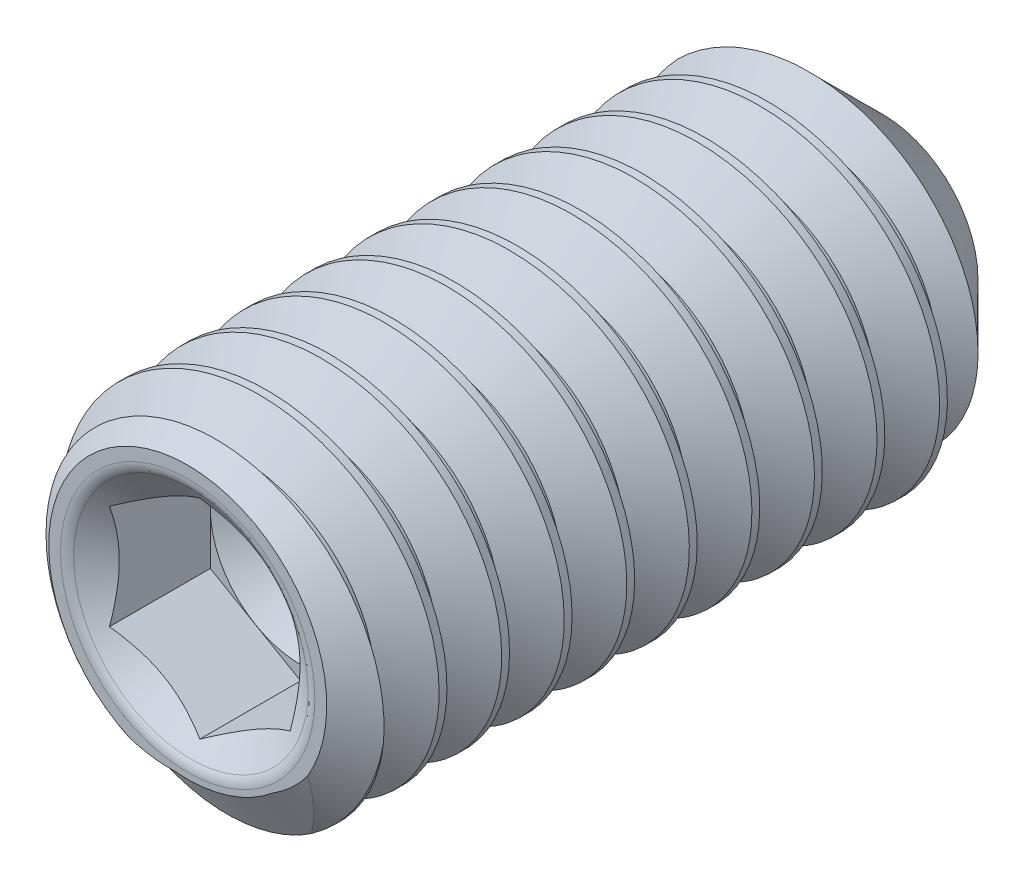
from build123d import *

# Parameters (mm, degrees)
CUT_SWEEP2_PITCH    = 0.45
CUT_EXTRUDE10_DEPTH = 0.8125
FILLET2_R           = 0.124722325


with BuildPart() as part:
    # Sketch22 → Revolve1 (revolve)
    with BuildSketch(Plane(origin=(0, 0, 0), x_dir=(0, 0, -1), z_dir=(1, 0, 0)), mode=Mode.PRIVATE) as revolve1_sk:
        Polygon((-2.294218417, 0), (-2.294218417, 1), (-2.119166532, 1.25), (2.140737716, 1.25), (2.705781583, 0.684956133), (2.294218417, 0), align=None)
    revolve(revolve1_sk.sketch.rotate(Axis((0, 0, -2.294218417), (0, 0, -1)), 180), axis=Axis((0, 0, -2.294218417), (0, 0, -1)))

    # Cut-Sweep2: the profile of Sketch28 profile screwed along a right-hand helix of 12.111111 turns, 6 arcs to a turn; built about Z, then put on its axis
    cut_sweep2_z = Axis((0, 0, 0), (0, 0, 1))
    cut_sweep2_corners = [(1.2503, 0, 0.000173205), (1.2503, 0, -0.393923205), (0.957716426, 0, -0.225), (0.957716426, 0, -0.16875)]
    with BuildLine(mode=Mode.PRIVATE) as cut_sweep2_profile:
        Line(cut_sweep2_corners[0], cut_sweep2_corners[1])
        Line(cut_sweep2_corners[1], cut_sweep2_corners[2])
        Line(cut_sweep2_corners[2], cut_sweep2_corners[3])
        Line(cut_sweep2_corners[3], cut_sweep2_corners[0])
    cut_sweep2_cap = Face(cut_sweep2_profile.wire())
    cut_sweep2_turn_angles = [0, 30, 60, 90, 120, 150, 180, 210, 240, 270, 300, 330, 360]
    cut_sweep2_turn_weights = [1, 0.8660254037844387, 1, 0.8660254037844387, 1, 0.8660254037844387, 1, 0.8660254037844387, 1, 0.8660254037844387, 1, 0.8660254037844387, 1]
    cut_sweep2_turn_rails = [Edge.make_bspline([Vector(p[0], p[1], 0).rotate(cut_sweep2_z, cut_sweep2_turn_angles[k]) / cut_sweep2_turn_weights[k] + Vector(0, 0, p[2] + CUT_SWEEP2_PITCH * cut_sweep2_turn_angles[k] / 360) for k in range(13)], [0, 0, 0, 1, 1, 2, 2, 3, 3, 4, 4, 5, 5, 6, 6, 6], 2, cut_sweep2_turn_weights) for p in cut_sweep2_corners]
    cut_sweep2_turn_sides = [Face.make_surface_from_curves(cut_sweep2_turn_rails[p[0]], cut_sweep2_turn_rails[p[1]]) for p in [(0, 1), (1, 2), (2, 3), (3, 0)]]
    cut_sweep2_last_angles = [4320, 4340, 4360]
    cut_sweep2_last_weights = [1, 0.9396926207859084, 1]
    cut_sweep2_last_rails = [Edge.make_bspline([Vector(p[0], p[1], 0).rotate(cut_sweep2_z, cut_sweep2_last_angles[k]) / cut_sweep2_last_weights[k] + Vector(0, 0, p[2] + CUT_SWEEP2_PITCH * cut_sweep2_last_angles[k] / 360) for k in range(3)], [0, 0, 0, 1, 1, 1], 2, cut_sweep2_last_weights) for p in cut_sweep2_corners]
    cut_sweep2_last_sides = [Face.make_surface_from_curves(cut_sweep2_last_rails[p[0]], cut_sweep2_last_rails[p[1]]) for p in [(0, 1), (1, 2), (2, 3), (3, 0)]]
    cut_sweep2 = Plane(origin=(0, 0, -2.705781583), x_dir=(0, 1, 0), z_dir=(0, 0, 1)) * Solid(Shell([*[p.moved(Location((0, 0, CUT_SWEEP2_PITCH * i))) for i in range(12) for p in cut_sweep2_turn_sides], *cut_sweep2_last_sides, cut_sweep2_cap, cut_sweep2_cap.rotate(cut_sweep2_z, 4360).moved(Location((0, 0, CUT_SWEEP2_PITCH * 4360 / 360)))]))
    add(cut_sweep2, mode=Mode.SUBTRACT)

    # Sketch23 → Cut-Extrude10 (cut)
    with BuildSketch(Plane.XY.offset(2.294218417)):
        Polygon((0, 0.75055535), (-0.65, 0.375277675), (-0.65, -0.375277675), (0, -0.75055535), (0.65, -0.375277675), (0.65, 0.375277675), align=None)
    extrude(amount=-CUT_EXTRUDE10_DEPTH, mode=Mode.SUBTRACT)

    # Cut-Extrude11 cone 1 section (through the dimple's axis) → Cut-Extrude11 (revolve, cut)
    with BuildSketch(Plane(origin=(0, 0, 2.294218417), x_dir=(0, -1, 0), z_dir=(1, 0, 0))):
        Polygon((0, 0), (0.875277675, 0), (0, 0.612876026), align=None)
    revolve(axis=Axis((0, 0, 2.294218417), (0, 0, -1)), mode=Mode.SUBTRACT)

    # Cut-Extrude12 cone 1 section (through the dimple's axis) → Cut-Extrude12 (revolve, cut)
    with BuildSketch(Plane(origin=(0, 0, 1.481718417), x_dir=(0, -1, 0), z_dir=(1, 0, 0))):
        Polygon((0, 0), (0.65, 0), (0, 0.375277675), align=None)
    revolve(axis=Axis((0, 0, 1.481718417), (0, 0, -1)), mode=Mode.SUBTRACT)

    # Fillet2
    fillet2_edges = [part.edges().sort_by_distance(p)[0] for p in [
        (0, 0.875277675, 2.294218417),
    ]]
    fillet(fillet2_edges, radius=FILLET2_R)


solid = part.part
